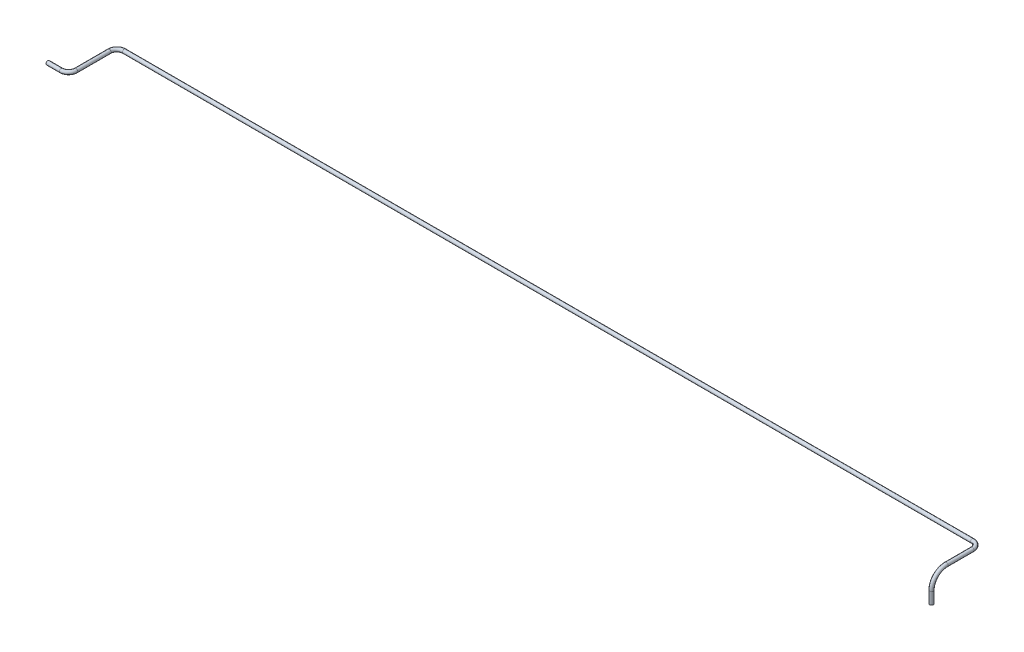
from build123d import *

# Parameters (mm, degrees)
SKETCH5_R   = 3.175
SKETCH5_R_2 = 2.667


with BuildPart() as part:
    # Sweep3: sweep along a curve in space
    with BuildLine() as sweep3_path:
        Line((0, 0, 0), (22.86, 0, 0))
        ThreePointArc((22.86, 0, 0), (31.840256121, 0, -3.719743879), (35.56, 0, -12.7))
        Line((35.56, 0, -12.7), (35.56, 0, -69.85))
        ThreePointArc((35.56, 0, -69.85), (39.279743879, 0, -78.830256121), (48.26, 0, -82.55))
        Line((48.26, 0, -82.55), (1499.658710354, 0, -82.55))
        ThreePointArc((1512.358710354, 0, -69.85), (1508.638966475, 0, -78.830256121), (1499.658710354, 0, -82.55))
        Line((1512.358710354, 0, -69.85), (1512.358710354, 0, -25.4))
        ThreePointArc((1512.358710354, 0, -25.4), (1512.358710354, -7.439487758, -7.439487758), (1512.358710354, -25.4, 0))
        Line((1512.358710354, -25.4, 0), (1512.358710354, -45.72, 0))
    # Sketch5 → Sweep3 (sweep)
    with BuildSketch(Plane(origin=(0, 0, 0), x_dir=(0, 0, -1), z_dir=(1, 0, 0))):
        Circle(SKETCH5_R)
        Circle(SKETCH5_R_2, mode=Mode.SUBTRACT)
    sweep(path=sweep3_path.line)


solid = part.part
